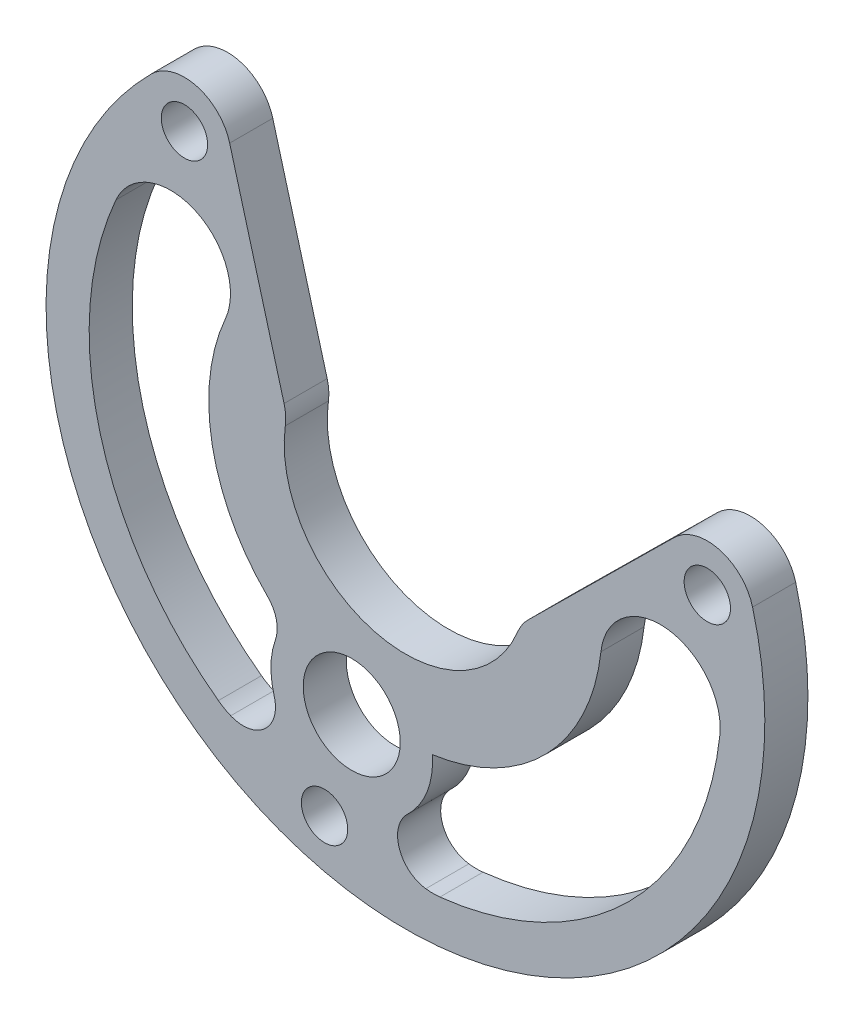
from build123d import *

# Parameters (mm, degrees)
SKETCH1_R           = 2.15
BOSS_EXTRUDE1_DEPTH = 4
SKETCH2_R           = 4.500000001
CUT_EXTRUDE1_DEPTH  = 10
BOSS_EXTRUDE2_START = -4
SKETCH3_R           = 7.499999999
SKETCH3_R_2         = 4.499999999
BOSS_EXTRUDE2_DEPTH = 4
FILLET1_R           = 3


with BuildPart() as part:
    # Sketch1 → Boss-Extrude1 (new body)
    with BuildSketch(Plane.XY):
        with BuildLine():
            Line((169.071208826, 34.599951739), (155.49789847, 21.187541922))
            ThreePointArc((155.49789847, 21.187541922), (154.94043739, 20.512931345), (154.52928773, 19.740391219))
            ThreePointArc((154.52928773, 19.740391219), (141.205165824, 13.133334454), (132.969666153, 25.51727441))
            ThreePointArc((132.969666153, 25.51727441), (132.999870165, 26.391888614), (132.854399997, 27.254849052))
            Line((132.854399997, 27.254849052), (127.805773323, 45.656991858))
            ThreePointArc((127.805773323, 45.656991858), (124.72411503, 48.711211723), (120.534868929, 47.582011153))
            ThreePointArc((120.534868929, 47.582011153), (135.485264927, -8.213626307), (176.330506388, 32.631615154))
            ThreePointArc((176.330506388, 32.631615154), (173.267113127, 35.704154585), (169.071208826, 34.599951739))
        make_face()
        with Locations((123.610783427, 44.506096654)):
            Circle(SKETCH1_R, mode=Mode.SUBTRACT)
        with Locations((172.128729044, 31.505752308)):
            Circle(SKETCH1_R, mode=Mode.SUBTRACT)
        with Locations((136.611127773, -4.011848962)):
            Circle(SKETCH1_R, mode=Mode.SUBTRACT)
        with BuildLine():
            ThreePointArc((127.410923425, 31.346666741), (124.564673615, 38.661300157), (117.250040198, 35.815050347))
            ThreePointArc((117.250040198, 35.815050347), (115.76695708, 16.403661026), (126.757039397, 0.334446311))
            ThreePointArc((126.757039397, 0.334446311), (134.51482266, 1.526838378), (133.322430592, 9.284621641))
            ThreePointArc((133.322430592, 9.284621641), (126.488733751, 19.276552427), (127.410923425, 31.346666741))
        make_face(mode=Mode.SUBTRACT)
        with BuildLine():
            ThreePointArc((173.291771113, 20.798713806), (168.38023766, 26.920955155), (162.25799631, 22.009421702))
            ThreePointArc((162.25799631, 22.009421702), (157.021578838, 11.095301243), (146.107458379, 5.858883771))
            ThreePointArc((146.107458379, 5.858883771), (141.195924926, -0.263357578), (147.318166275, -5.174891032))
            ThreePointArc((147.318166275, -5.174891032), (164.870464109, 3.246415972), (173.291771113, 20.798713806))
        make_face(mode=Mode.SUBTRACT)
    extrude(amount=BOSS_EXTRUDE1_DEPTH)

    # Sketch2 → Cut-Extrude1 (cut)
    with BuildSketch(Plane(origin=(0, 0, 0), x_dir=(-1, 0, 0), z_dir=(0, 0, -1))):
        with Locations((-139.134613463, 5.405927844)):
            Circle(SKETCH2_R)
    extrude(amount=-CUT_EXTRUDE1_DEPTH, mode=Mode.SUBTRACT)

    # Sketch3 → Boss-Extrude2 (add)
    with BuildSketch(Plane.XY.offset(4).offset(BOSS_EXTRUDE2_START)):
        with Locations((139.134613463, 5.405927844)):
            Circle(SKETCH3_R)
        with Locations((139.134613463, 5.405927844)):
            Circle(SKETCH3_R_2, mode=Mode.SUBTRACT)
    extrude(amount=BOSS_EXTRUDE2_DEPTH)

    # Fillet1
    fillet1_edges = [part.edges().sort_by_distance(p)[0] for p in [
        (133.492654971, 0.464439773, 2),
        (132.912874844, 9.594002407, 2),
        (141.549948809, -1.694505605, 2),
    ]]
    fillet(fillet1_edges, radius=FILLET1_R)


solid = part.part
